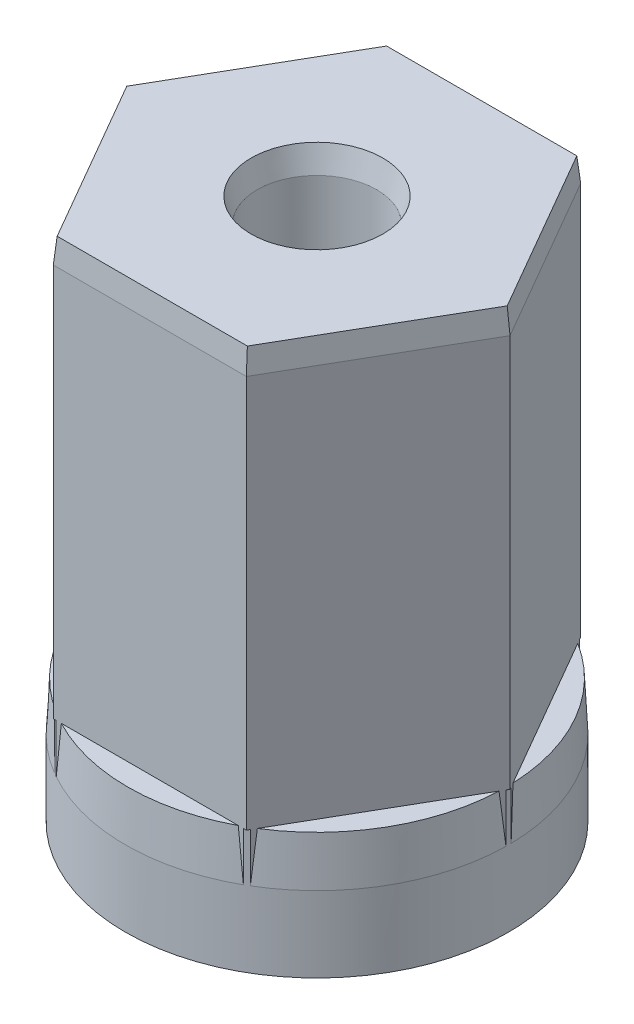
from build123d import *

# Parameters (mm, degrees)
SKETCH1_R           = 7.85
BOSS_EXTRUDE1_DEPTH = 5.1
BOSS_EXTRUDE2_DEPTH = 17.1
CHAMFER1_SIZE       = 2
CHAMFER1_SIZE_2     = 0.1
CHAMFER2_SIZE       = 0.1
CHAMFER2_SIZE2      = 1
SKETCH3_R           = 2.45
CUT_EXTRUDE1_DEPTH  = 25.840004697
SKETCH4_R           = 3.95
SKETCH4_R_2         = 2.45
BOSS_EXTRUDE3_DEPTH = 2.3
CHAMFER4_SIZE       = 0.25
CHAMFER4_SIZE2      = 1


with BuildPart() as part:
    # Sketch1 → Boss-Extrude1 (new body)
    with BuildSketch(Plane(origin=(0, 0, 0), x_dir=(1, 0, 0), z_dir=(0, 1, 0))):
        with Locations(Location((0, 0, 0), (0, 0, 270))):
            Circle(SKETCH1_R)
    extrude(amount=BOSS_EXTRUDE1_DEPTH)

    # Sketch2 → Boss-Extrude2 (add)
    with BuildSketch(Plane(origin=(0, 5.1, 0), x_dir=(1, 0, 0), z_dir=(0, 1, 0))):
        Polygon((3.954849344, -6.85), (7.909698688, 0), (3.954849344, 6.85), (-3.954849344, 6.85), (-7.909698688, 0), (-3.954849344, -6.85), align=None)
    extrude(amount=BOSS_EXTRUDE2_DEPTH)

    # Chamfer1
    # the kernel refuses this chamfer: 2, 0.1 mm, written as the material it takes off along each edge
    with BuildSketch(Plane(origin=(0, 5.1, 0), x_dir=(-0.12524723845316335, 0, 0.9921255612370121), z_dir=(-0.9921255612370121, 0, -0.12524723845316335))) as chamfer1_piece_1_section:
        Polygon((7.85, -CHAMFER1_SIZE), (7.85 - CHAMFER1_SIZE_2, 0), (7.85, 0), align=None)
    chamfer1_piece_1 = revolve(axis=Axis((0, 5.1, 0), (0, 1, 0)), revolution_arc=134.390067419, mode=Mode.PRIVATE)
    chamfer1_piece_1 = split(chamfer1_piece_1, bisect_by=Plane(origin=(1.492584192, 4.100393964, 6.85), z_dir=(0, 0, 1)), keep=Keep.TOP, mode=Mode.PRIVATE)
    add(chamfer1_piece_1, mode=Mode.SUBTRACT)
    with BuildSketch(Plane(origin=(0, 5.1, 0), x_dir=(-0.12524723845316335, 0, 0.9921255612370121), z_dir=(-0.9921255612370121, 0, -0.12524723845316335))) as chamfer1_piece_2_section:
        Polygon((7.85, -CHAMFER1_SIZE), (7.85 - CHAMFER1_SIZE_2, 0), (7.85, 0), align=None)
    chamfer1_piece_2 = revolve(axis=Axis((0, 5.1, 0), (0, 1, 0)), revolution_arc=134.390067419, mode=Mode.PRIVATE)
    chamfer1_piece_2 = split(chamfer1_piece_2, bisect_by=Plane(origin=(5.932274016, 4.100460799, 3.425), z_dir=(0.8660254037844386, 0, 0.5000000000000001)), keep=Keep.TOP, mode=Mode.PRIVATE)
    add(chamfer1_piece_2, mode=Mode.SUBTRACT)
    with BuildSketch(Plane(origin=(0, 5.1, 0), x_dir=(-0.12524723845316335, 0, 0.9921255612370121), z_dir=(-0.9921255612370121, 0, -0.12524723845316335))) as chamfer1_piece_3_section:
        Polygon((7.85, -CHAMFER1_SIZE), (7.85 - CHAMFER1_SIZE_2, 0), (7.85, 0), align=None)
    chamfer1_piece_3 = revolve(axis=Axis((0, 5.1, 0), (0, 1, 0)), revolution_arc=134.390067419, mode=Mode.PRIVATE)
    chamfer1_piece_3 = split(chamfer1_piece_3, bisect_by=Plane(origin=(6.678566112, 4.100393964, -2.132384173), z_dir=(0.8660254037844385, 0, -0.5000000000000003)), keep=Keep.TOP, mode=Mode.PRIVATE)
    add(chamfer1_piece_3, mode=Mode.SUBTRACT)
    with BuildSketch(Plane(origin=(0, 5.1, 0), x_dir=(0.796582320548557, 0, 0.6045300708728027), z_dir=(-0.6045300708728027, 0, 0.796582320548557))) as chamfer1_piece_4_section:
        Polygon((7.85, -CHAMFER1_SIZE), (7.85 - CHAMFER1_SIZE_2, 0), (7.85, 0), align=None)
    chamfer1_piece_4 = revolve(axis=Axis((0, 5.1, 0), (0, 1, 0)), revolution_arc=134.390067419, mode=Mode.PRIVATE)
    chamfer1_piece_4 = split(chamfer1_piece_4, bisect_by=Plane(origin=(6.678566112, 4.100393964, 2.132384173), z_dir=(0.8660254037844386, 0, 0.5000000000000001)), keep=Keep.TOP, mode=Mode.PRIVATE)
    add(chamfer1_piece_4, mode=Mode.SUBTRACT)
    with BuildSketch(Plane(origin=(0, 5.1, 0), x_dir=(0.796582320548557, 0, 0.6045300708728027), z_dir=(-0.6045300708728027, 0, 0.796582320548557))) as chamfer1_piece_5_section:
        Polygon((7.85, -CHAMFER1_SIZE), (7.85 - CHAMFER1_SIZE_2, 0), (7.85, 0), align=None)
    chamfer1_piece_5 = revolve(axis=Axis((0, 5.1, 0), (0, 1, 0)), revolution_arc=134.390067419, mode=Mode.PRIVATE)
    chamfer1_piece_5 = split(chamfer1_piece_5, bisect_by=Plane(origin=(5.932274016, 4.100460799, -3.425), z_dir=(0.8660254037844385, 0, -0.5000000000000003)), keep=Keep.TOP, mode=Mode.PRIVATE)
    add(chamfer1_piece_5, mode=Mode.SUBTRACT)
    with BuildSketch(Plane(origin=(0, 5.1, 0), x_dir=(0.796582320548557, 0, 0.6045300708728027), z_dir=(-0.6045300708728027, 0, 0.796582320548557))) as chamfer1_piece_6_section:
        Polygon((7.85, -CHAMFER1_SIZE), (7.85 - CHAMFER1_SIZE_2, 0), (7.85, 0), align=None)
    chamfer1_piece_6 = revolve(axis=Axis((0, 5.1, 0), (0, 1, 0)), revolution_arc=134.390067419, mode=Mode.PRIVATE)
    chamfer1_piece_6 = split(chamfer1_piece_6, bisect_by=Plane(origin=(1.492584192, 4.100393964, -6.85), z_dir=(0, 0, -1)), keep=Keep.TOP, mode=Mode.PRIVATE)
    add(chamfer1_piece_6, mode=Mode.SUBTRACT)
    with BuildSketch(Plane(origin=(0, 5.1, 0), x_dir=(0.9218295590017263, 0, -0.3875954903642235), z_dir=(0.3875954903642235, 0, 0.9218295590017263))) as chamfer1_piece_7_section:
        Polygon((7.85, -CHAMFER1_SIZE), (7.85 - CHAMFER1_SIZE_2, 0), (7.85, 0), align=None)
    chamfer1_piece_7 = revolve(axis=Axis((0, 5.1, 0), (0, 1, 0)), revolution_arc=134.390067419, mode=Mode.PRIVATE)
    chamfer1_piece_7 = split(chamfer1_piece_7, bisect_by=Plane(origin=(5.18598192, 4.100393964, -4.717615827), z_dir=(0.8660254037844385, 0, -0.5000000000000003)), keep=Keep.TOP, mode=Mode.PRIVATE)
    add(chamfer1_piece_7, mode=Mode.SUBTRACT)
    with BuildSketch(Plane(origin=(0, 5.1, 0), x_dir=(0.9218295590017263, 0, -0.3875954903642235), z_dir=(0.3875954903642235, 0, 0.9218295590017263))) as chamfer1_piece_8_section:
        Polygon((7.85, -CHAMFER1_SIZE), (7.85 - CHAMFER1_SIZE_2, 0), (7.85, 0), align=None)
    chamfer1_piece_8 = revolve(axis=Axis((0, 5.1, 0), (0, 1, 0)), revolution_arc=134.390067419, mode=Mode.PRIVATE)
    chamfer1_piece_8 = split(chamfer1_piece_8, bisect_by=Plane(origin=(0, 4.100460799, -6.85), z_dir=(0, 0, -1)), keep=Keep.TOP, mode=Mode.PRIVATE)
    add(chamfer1_piece_8, mode=Mode.SUBTRACT)
    with BuildSketch(Plane(origin=(0, 5.1, 0), x_dir=(0.9218295590017263, 0, -0.3875954903642235), z_dir=(0.3875954903642235, 0, 0.9218295590017263))) as chamfer1_piece_9_section:
        Polygon((7.85, -CHAMFER1_SIZE), (7.85 - CHAMFER1_SIZE_2, 0), (7.85, 0), align=None)
    chamfer1_piece_9 = revolve(axis=Axis((0, 5.1, 0), (0, 1, 0)), revolution_arc=134.390067419, mode=Mode.PRIVATE)
    chamfer1_piece_9 = split(chamfer1_piece_9, bisect_by=Plane(origin=(-5.18598192, 4.100393964, -4.717615827), z_dir=(-0.8660254037844387, 0, -0.49999999999999994)), keep=Keep.TOP, mode=Mode.PRIVATE)
    add(chamfer1_piece_9, mode=Mode.SUBTRACT)
    with BuildSketch(Plane(origin=(0, 5.1, 0), x_dir=(0.12524723845316238, 0, -0.9921255612370122), z_dir=(0.9921255612370122, 0, 0.12524723845316238))) as chamfer1_piece_10_section:
        Polygon((7.85, -CHAMFER1_SIZE), (7.85 - CHAMFER1_SIZE_2, 0), (7.85, 0), align=None)
    chamfer1_piece_10 = revolve(axis=Axis((0, 5.1, 0), (0, 1, 0)), revolution_arc=134.390067419, mode=Mode.PRIVATE)
    chamfer1_piece_10 = split(chamfer1_piece_10, bisect_by=Plane(origin=(-1.492584192, 4.100393964, -6.85), z_dir=(0, 0, -1)), keep=Keep.TOP, mode=Mode.PRIVATE)
    add(chamfer1_piece_10, mode=Mode.SUBTRACT)
    with BuildSketch(Plane(origin=(0, 5.1, 0), x_dir=(0.12524723845316238, 0, -0.9921255612370122), z_dir=(0.9921255612370122, 0, 0.12524723845316238))) as chamfer1_piece_11_section:
        Polygon((7.85, -CHAMFER1_SIZE), (7.85 - CHAMFER1_SIZE_2, 0), (7.85, 0), align=None)
    chamfer1_piece_11 = revolve(axis=Axis((0, 5.1, 0), (0, 1, 0)), revolution_arc=134.390067419, mode=Mode.PRIVATE)
    chamfer1_piece_11 = split(chamfer1_piece_11, bisect_by=Plane(origin=(-5.932274016, 4.100460799, -3.425), z_dir=(-0.8660254037844387, 0, -0.49999999999999994)), keep=Keep.TOP, mode=Mode.PRIVATE)
    add(chamfer1_piece_11, mode=Mode.SUBTRACT)
    with BuildSketch(Plane(origin=(0, 5.1, 0), x_dir=(0.12524723845316238, 0, -0.9921255612370122), z_dir=(0.9921255612370122, 0, 0.12524723845316238))) as chamfer1_piece_12_section:
        Polygon((7.85, -CHAMFER1_SIZE), (7.85 - CHAMFER1_SIZE_2, 0), (7.85, 0), align=None)
    chamfer1_piece_12 = revolve(axis=Axis((0, 5.1, 0), (0, 1, 0)), revolution_arc=134.390067419, mode=Mode.PRIVATE)
    chamfer1_piece_12 = split(chamfer1_piece_12, bisect_by=Plane(origin=(-6.678566112, 4.100393964, 2.132384173), z_dir=(-0.8660254037844386, 0, 0.5000000000000001)), keep=Keep.TOP, mode=Mode.PRIVATE)
    add(chamfer1_piece_12, mode=Mode.SUBTRACT)
    with BuildSketch(Plane(origin=(0, 5.1, 0), x_dir=(-0.7965823205485564, 0, -0.6045300708728035), z_dir=(0.6045300708728035, 0, -0.7965823205485564))) as chamfer1_piece_13_section:
        Polygon((7.85, -CHAMFER1_SIZE), (7.85 - CHAMFER1_SIZE_2, 0), (7.85, 0), align=None)
    chamfer1_piece_13 = revolve(axis=Axis((0, 5.1, 0), (0, 1, 0)), revolution_arc=134.390067419, mode=Mode.PRIVATE)
    chamfer1_piece_13 = split(chamfer1_piece_13, bisect_by=Plane(origin=(-6.678566112, 4.100393964, -2.132384173), z_dir=(-0.8660254037844387, 0, -0.49999999999999994)), keep=Keep.TOP, mode=Mode.PRIVATE)
    add(chamfer1_piece_13, mode=Mode.SUBTRACT)
    with BuildSketch(Plane(origin=(0, 5.1, 0), x_dir=(-0.7965823205485564, 0, -0.6045300708728035), z_dir=(0.6045300708728035, 0, -0.7965823205485564))) as chamfer1_piece_14_section:
        Polygon((7.85, -CHAMFER1_SIZE), (7.85 - CHAMFER1_SIZE_2, 0), (7.85, 0), align=None)
    chamfer1_piece_14 = revolve(axis=Axis((0, 5.1, 0), (0, 1, 0)), revolution_arc=134.390067419, mode=Mode.PRIVATE)
    chamfer1_piece_14 = split(chamfer1_piece_14, bisect_by=Plane(origin=(-5.932274016, 4.100460799, 3.425), z_dir=(-0.8660254037844386, 0, 0.5000000000000001)), keep=Keep.TOP, mode=Mode.PRIVATE)
    add(chamfer1_piece_14, mode=Mode.SUBTRACT)
    with BuildSketch(Plane(origin=(0, 5.1, 0), x_dir=(-0.7965823205485564, 0, -0.6045300708728035), z_dir=(0.6045300708728035, 0, -0.7965823205485564))) as chamfer1_piece_15_section:
        Polygon((7.85, -CHAMFER1_SIZE), (7.85 - CHAMFER1_SIZE_2, 0), (7.85, 0), align=None)
    chamfer1_piece_15 = revolve(axis=Axis((0, 5.1, 0), (0, 1, 0)), revolution_arc=134.390067419, mode=Mode.PRIVATE)
    chamfer1_piece_15 = split(chamfer1_piece_15, bisect_by=Plane(origin=(-1.492584192, 4.100393964, 6.85), z_dir=(0, 0, 1)), keep=Keep.TOP, mode=Mode.PRIVATE)
    add(chamfer1_piece_15, mode=Mode.SUBTRACT)
    with BuildSketch(Plane(origin=(0, 5.1, 0), x_dir=(-0.9217969096478654, 0, 0.38767313211473), z_dir=(-0.38767313211473, 0, -0.9217969096478654))) as chamfer1_piece_16_section:
        Polygon((7.85, -CHAMFER1_SIZE), (7.85 - CHAMFER1_SIZE_2, 0), (7.85, 0), align=None)
    chamfer1_piece_16 = revolve(axis=Axis((0, 5.1, 0), (0, 1, 0)), revolution_arc=67.190207846, mode=Mode.PRIVATE)
    chamfer1_piece_16 = split(chamfer1_piece_16, bisect_by=Plane(origin=(-5.185820577, 4.100393946, 4.717895281), z_dir=(-0.8660254037844386, 0, 0.5000000000000001)), keep=Keep.TOP, mode=Mode.PRIVATE)
    add(chamfer1_piece_16, mode=Mode.SUBTRACT)
    with BuildSketch(Plane(origin=(0, 5.1, 0), x_dir=(-0.9217969096478654, 0, 0.38767313211473), z_dir=(-0.38767313211473, 0, -0.9217969096478654))) as chamfer1_piece_17_section:
        Polygon((7.85, -CHAMFER1_SIZE), (7.85 - CHAMFER1_SIZE_2, 0), (7.85, 0), align=None)
    chamfer1_piece_17 = revolve(axis=Axis((0, 5.1, 0), (0, 1, 0)), revolution_arc=67.190207846, mode=Mode.PRIVATE)
    chamfer1_piece_17 = split(chamfer1_piece_17, bisect_by=Plane(origin=(-1.970388485, 4.100365736, 6.85), z_dir=(0, 0, 1)), keep=Keep.TOP, mode=Mode.PRIVATE)
    add(chamfer1_piece_17, mode=Mode.SUBTRACT)
    with BuildSketch(Plane(origin=(0, 5.1, 0), x_dir=(0, 0, 1), z_dir=(-1, 0, 0))) as chamfer1_piece_18_section:
        Polygon((7.85, -CHAMFER1_SIZE), (7.85 - CHAMFER1_SIZE_2, 0), (7.85, 0), align=None)
    chamfer1_piece_18 = revolve(axis=Axis((0, 5.1, 0), (0, 1, 0)), revolution_arc=67.190207846, mode=Mode.PRIVATE)
    chamfer1_piece_18 = split(chamfer1_piece_18, bisect_by=Plane(origin=(1.970388485, 4.100365736, 6.85), z_dir=(0, 0, 1)), keep=Keep.TOP, mode=Mode.PRIVATE)
    add(chamfer1_piece_18, mode=Mode.SUBTRACT)
    with BuildSketch(Plane(origin=(0, 5.1, 0), x_dir=(0, 0, 1), z_dir=(-1, 0, 0))) as chamfer1_piece_19_section:
        Polygon((7.85, -CHAMFER1_SIZE), (7.85 - CHAMFER1_SIZE_2, 0), (7.85, 0), align=None)
    chamfer1_piece_19 = revolve(axis=Axis((0, 5.1, 0), (0, 1, 0)), revolution_arc=67.190207846, mode=Mode.PRIVATE)
    chamfer1_piece_19 = split(chamfer1_piece_19, bisect_by=Plane(origin=(5.185820577, 4.100393946, 4.717895281), z_dir=(0.8660254037844386, 0, 0.5000000000000001)), keep=Keep.TOP, mode=Mode.PRIVATE)
    add(chamfer1_piece_19, mode=Mode.SUBTRACT)

    # Chamfer2
    chamfer2_edges = [part.edges().sort_by_distance(p)[0] for p in [
        (-5.932274016, 22.2, 3.425),
        (-5.932274016, 22.2, -3.425),
        (0, 22.2, -6.85),
        (5.932274016, 22.2, -3.425),
        (5.932274016, 22.2, 3.425),
        (0, 22.2, 6.85),
    ]]
    chamfer2_side = [part.faces().sort_by_distance(p)[0] for p in [
        (0, 22.2, 0),
    ]]
    chamfer(chamfer2_edges, length=CHAMFER2_SIZE, length2=CHAMFER2_SIZE2, reference=chamfer2_side[0])

    # Sketch3 → Cut-Extrude1 (cut, through all)
    with BuildSketch(Plane(origin=(0, 22.2, 0), x_dir=(1, 0, 0), z_dir=(0, 1, 0))):
        with Locations(Location((0, 0, 0), (0, 0, 270))):
            Circle(SKETCH3_R)
    extrude(amount=-CUT_EXTRUDE1_DEPTH, mode=Mode.SUBTRACT)

    # Sketch4 → Boss-Extrude3 (add)
    with BuildSketch(Plane.XZ):
        with Locations(Location((0, 0, 0), (0, 0, 90))):
            Circle(SKETCH4_R)
        with Locations(Location((0, 0, 0), (0, 0, 90))):
            Circle(SKETCH4_R_2, mode=Mode.SUBTRACT)
    extrude(amount=BOSS_EXTRUDE3_DEPTH)

    # Chamfer4
    chamfer4_edges = [part.edges().sort_by_distance(p)[0] for p in [
        (0, 22.2, -2.45),
    ]]
    chamfer4_side = [part.faces().sort_by_distance(p)[0] for p in [
        (-5.667083262, 22.2, 3.271892047),
    ]]
    chamfer(chamfer4_edges, length=CHAMFER4_SIZE, length2=CHAMFER4_SIZE2, reference=chamfer4_side[0])


solid = part.part
